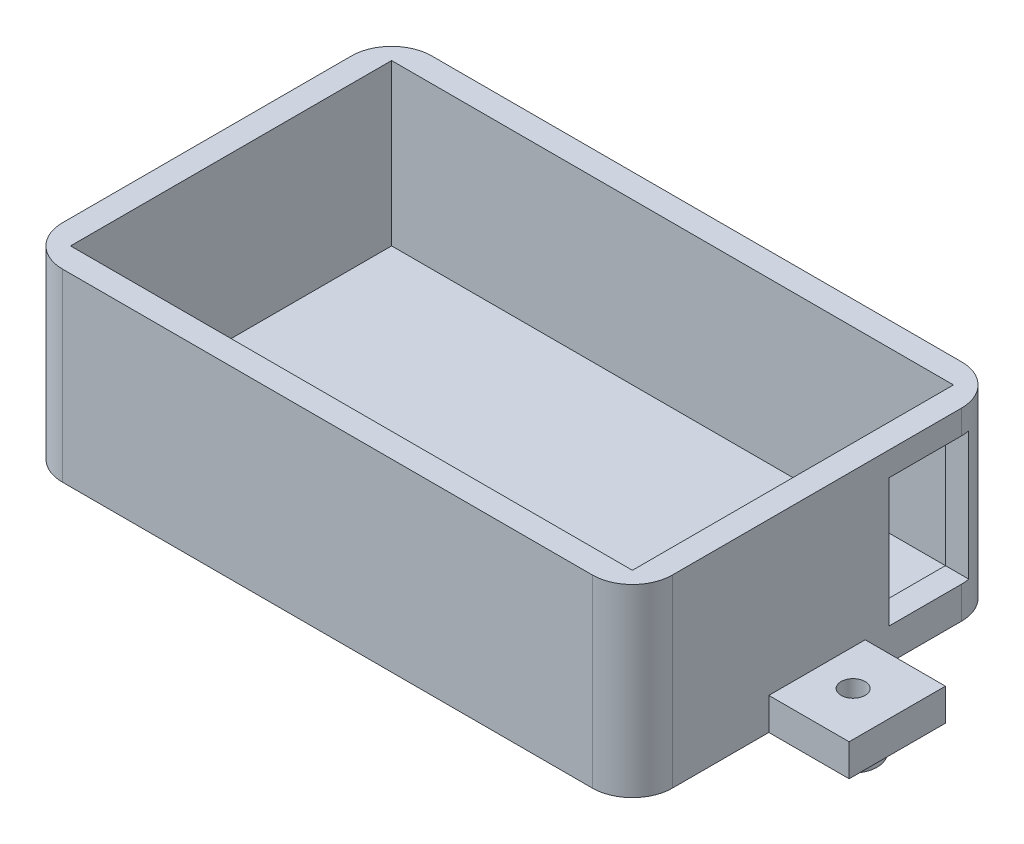
from build123d import *

# Parameters (mm, degrees)
CROQUIS1_W                     = 76
CROQUIS1_H                     = 46
CROQUIS1_W_2                   = 70
CROQUIS1_H_2                   = 40
SALIENTE_EXTRUIR1_DEPTH        = 20
CROQUIS2_W                     = 76
CROQUIS2_H                     = 46
SALIENTE_EXTRUIR2_DEPTH        = 3
SALIENTE_EXTRUIR3_DEPTH        = 3
SALIENTE_EXTRUIR3_DEPTH_BACK   = 4
CROQUIS3_R                     = 3
CROQUIS3_R_2                   = 1.5
SALIENTE_EXTRUIR3_2_DEPTH      = 3
SALIENTE_EXTRUIR3_2_DEPTH_BACK = 4
CROQUIS4_W                     = 12
CROQUIS4_H                     = 4
SALIENTE_EXTRUIR4_DEPTH        = 10
CROQUIS5_W                     = 12
CROQUIS5_H                     = 4
SALIENTE_EXTRUIR5_DEPTH        = 10
CORTAR_EXTRUIR1_START          = -10
CROQUIS6_R                     = 1.5
CORTAR_EXTRUIR1_DEPTH          = 10
CROQUIS7_W                     = 10
CROQUIS7_H                     = 16
CORTAR_EXTRUIR2_DEPTH          = 10
REDONDEO1_R                    = 5


with BuildPart() as part:
    # Croquis1 → Saliente-Extruir1 (new body)
    with BuildSketch(Plane(origin=(0, 0, 0), x_dir=(1, 0, 0), z_dir=(0, 1, 0))):
        Rectangle(CROQUIS1_W, CROQUIS1_H)
        Rectangle(CROQUIS1_W_2, CROQUIS1_H_2, mode=Mode.SUBTRACT)
    extrude(amount=SALIENTE_EXTRUIR1_DEPTH)

    # Croquis2 → Saliente-Extruir2 (add)
    with BuildSketch(Plane.XZ):
        Rectangle(CROQUIS2_W, CROQUIS2_H)
    extrude(amount=SALIENTE_EXTRUIR2_DEPTH)



with BuildPart() as body_2:
    # Croquis3 → Saliente-Extruir3 (new, two sides: drawn at the far end of the back side and taken through both)
    with BuildSketch(Plane.XZ.offset(3).offset(-SALIENTE_EXTRUIR3_DEPTH_BACK)):
        with Locations(Location((42.5, 0, 0), (0, 0, 270))):
            Circle(CROQUIS3_R)
        with Locations(Location((42.5, 0, 0), (0, 0, 270))):
            Circle(CROQUIS3_R_2, mode=Mode.SUBTRACT)
    extrude(amount=SALIENTE_EXTRUIR3_DEPTH + SALIENTE_EXTRUIR3_DEPTH_BACK)


with BuildPart() as body_3:
    # Croquis3 → Saliente-Extruir3 2 (new, two sides: drawn at the far end of the back side and taken through both)
    with BuildSketch(Plane.XZ.offset(3).offset(-SALIENTE_EXTRUIR3_2_DEPTH_BACK)):
        with Locations(Location((-42.5, 0, 0), (0, 0, 270))):
            Circle(CROQUIS3_R)
        with Locations(Location((-42.5, 0, 0), (0, 0, 270))):
            Circle(CROQUIS3_R_2, mode=Mode.SUBTRACT)
    extrude(amount=SALIENTE_EXTRUIR3_2_DEPTH + SALIENTE_EXTRUIR3_2_DEPTH_BACK)


with BuildPart() as part_1:
    add(part.part)

    add(body_2.part)  # Saliente-Extruir4 merges body 2
    # Croquis4 → Saliente-Extruir4 (add)
    with BuildSketch(Plane(origin=(38, 0, 0), x_dir=(0, 0, -1), z_dir=(1, 0, 0))):
        with Locations((0, -1)):
            Rectangle(CROQUIS4_W, CROQUIS4_H)
    extrude(amount=SALIENTE_EXTRUIR4_DEPTH)


    add(body_3.part)  # Saliente-Extruir5 merges body 3
    # Croquis5 → Saliente-Extruir5 (add)
    with BuildSketch(Plane.ZY.offset(38)):
        with Locations((0, -1)):
            Rectangle(CROQUIS5_W, CROQUIS5_H)
    extrude(amount=SALIENTE_EXTRUIR5_DEPTH)

    # Croquis6 → Cortar-Extruir1 (cut)
    with BuildSketch(Plane.XZ.offset(3).offset(CORTAR_EXTRUIR1_START)):
        with Locations(Location((-42.5, 0, 0), (0, 0, 270))):
            Circle(CROQUIS6_R)
        with Locations(Location((42.5, 0, 0), (0, 0, 270))):
            Circle(CROQUIS6_R)
    extrude(amount=CORTAR_EXTRUIR1_DEPTH, mode=Mode.SUBTRACT)

    # Croquis7 → Cortar-Extruir2 (cut)
    with BuildSketch(Plane(origin=(38, 0, 0), x_dir=(0, 0, -1), z_dir=(1, 0, 0))):
        with Locations((14, 9)):
            Rectangle(CROQUIS7_W, CROQUIS7_H)
    extrude(amount=-CORTAR_EXTRUIR2_DEPTH, mode=Mode.SUBTRACT)

    # Redondeo1
    # the kernel refuses this fillet: 5 mm, written as the material it takes off along each edge
    with BuildSketch(Plane(origin=(-38, 32.5, 23), x_dir=(1, 0, 0), z_dir=(0, -1, 0)), Plane(origin=(-38, 32.5, -23), x_dir=(0, 0, 1), z_dir=(0, -1, 0)), Plane(origin=(38, -15.5, -23), x_dir=(0, 0, 1), z_dir=(0, 1, 0)), Plane(origin=(38, -15.5, 23), x_dir=(-1, 0, 0), z_dir=(0, 1, 0))) as redondeo1_piece_1:
        with BuildLine():
            CenterArc((REDONDEO1_R, -REDONDEO1_R), REDONDEO1_R, 90, 90)
            Line((0, -REDONDEO1_R), (0, 0))
            Line((0, 0), (REDONDEO1_R, 0))
        make_face()
    extrude(amount=48, mode=Mode.SUBTRACT)


solid = part_1.part
